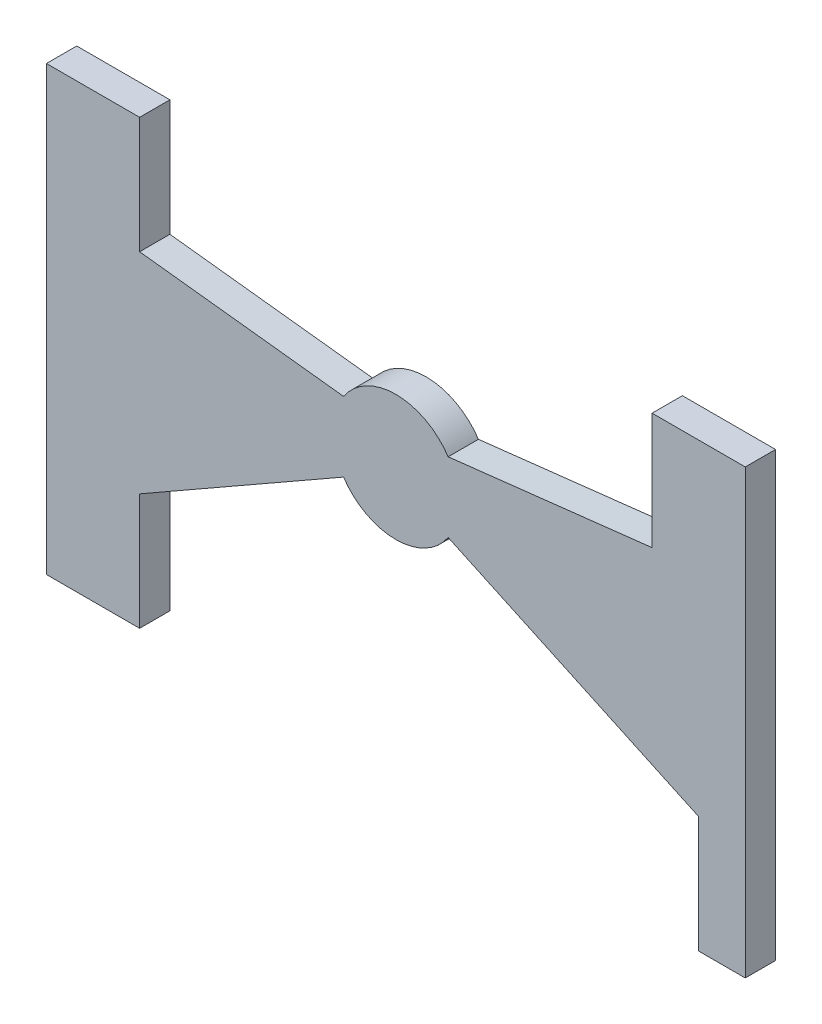
from build123d import *

# Parameters (mm, degrees)
ESQUISSE1_W             = 3000
ESQUISSE1_H             = 1900
BOSS_EXTRU_1_DEPTH      = 130
ENL_V_MAT_EXTRU_1_DEPTH = 130


with BuildPart() as part:
    # Esquisse1 → Boss.-Extru.1 (new body)
    with BuildSketch(Plane.XY):
        with Locations((1500, 950)):
            Rectangle(ESQUISSE1_W, ESQUISSE1_H)
    extrude(amount=-BOSS_EXTRU_1_DEPTH)

    # Esquisse4 → Enlèv. mat.-Extru.1 (cut)
    with BuildSketch(Plane.XY):
        with BuildLine():
            Line((400, 500), (400, 0))
            Line((400, 0), (2800, 0))
            Line((2800, 0), (2800, 500))
            Line((2800, 500), (1724.499443206, 1000))
            ThreePointArc((1724.499443206, 1000), (1500, 880), (1275.500556794, 1000))
            Line((1275.500556794, 1000), (400, 500))
        make_face()
        with BuildLine():
            Line((400, 1400), (1275.500556794, 1300))
            ThreePointArc((1275.500556794, 1300), (1500, 1420), (1724.499443206, 1300))
            Line((1724.499443206, 1300), (2600, 1400))
            Line((2600, 1400), (2600, 1900))
            Line((2600, 1900), (400, 1900))
            Line((400, 1900), (400, 1400))
        make_face()
    extrude(amount=-ENL_V_MAT_EXTRU_1_DEPTH, mode=Mode.SUBTRACT)


solid = part.part
